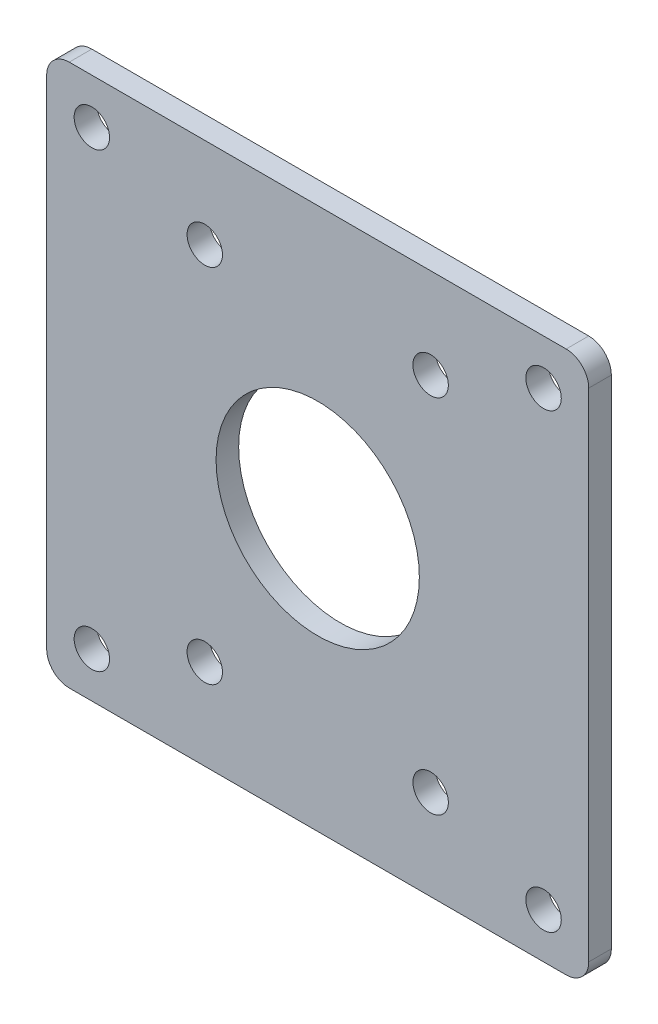
from build123d import *

# Parameters (mm, degrees)
SKETCH1_W           = 76.2
SKETCH1_H           = 76.2
SKETCH1_R           = 2.4892
SKETCH1_R_2         = 14.2875
BOSS_EXTRUDE1_DEPTH = 3.175
FILLET1_R           = 3.175


with BuildPart() as part:
    # Sketch1 → Boss-Extrude1 (new body)
    with BuildSketch(Plane.XY):
        Rectangle(SKETCH1_W, SKETCH1_H)
        with Locations((-31.75, 31.75)):
            Circle(SKETCH1_R, mode=Mode.SUBTRACT)
        with Locations((31.75, 31.75)):
            Circle(SKETCH1_R, mode=Mode.SUBTRACT)
        with Locations((31.75, -31.75)):
            Circle(SKETCH1_R, mode=Mode.SUBTRACT)
        with Locations((-31.75, -31.75)):
            Circle(SKETCH1_R, mode=Mode.SUBTRACT)
        Circle(SKETCH1_R_2, mode=Mode.SUBTRACT)
        with Locations((-15.875, -25.4)):
            Circle(SKETCH1_R, mode=Mode.SUBTRACT)
        with Locations((15.875, -25.4)):
            Circle(SKETCH1_R, mode=Mode.SUBTRACT)
        with Locations((15.875, 25.4)):
            Circle(SKETCH1_R, mode=Mode.SUBTRACT)
        with Locations((-15.875, 25.4)):
            Circle(SKETCH1_R, mode=Mode.SUBTRACT)
    extrude(amount=BOSS_EXTRUDE1_DEPTH)

    # Fillet1
    fillet1_edges = [part.edges().sort_by_distance(p)[0] for p in [
        (38.1, -38.1, 1.5875),
        (-38.1, -38.1, 1.5875),
        (-38.1, 38.1, 1.5875),
        (38.1, 38.1, 1.5875),
    ]]
    fillet(fillet1_edges, radius=FILLET1_R)


solid = part.part
